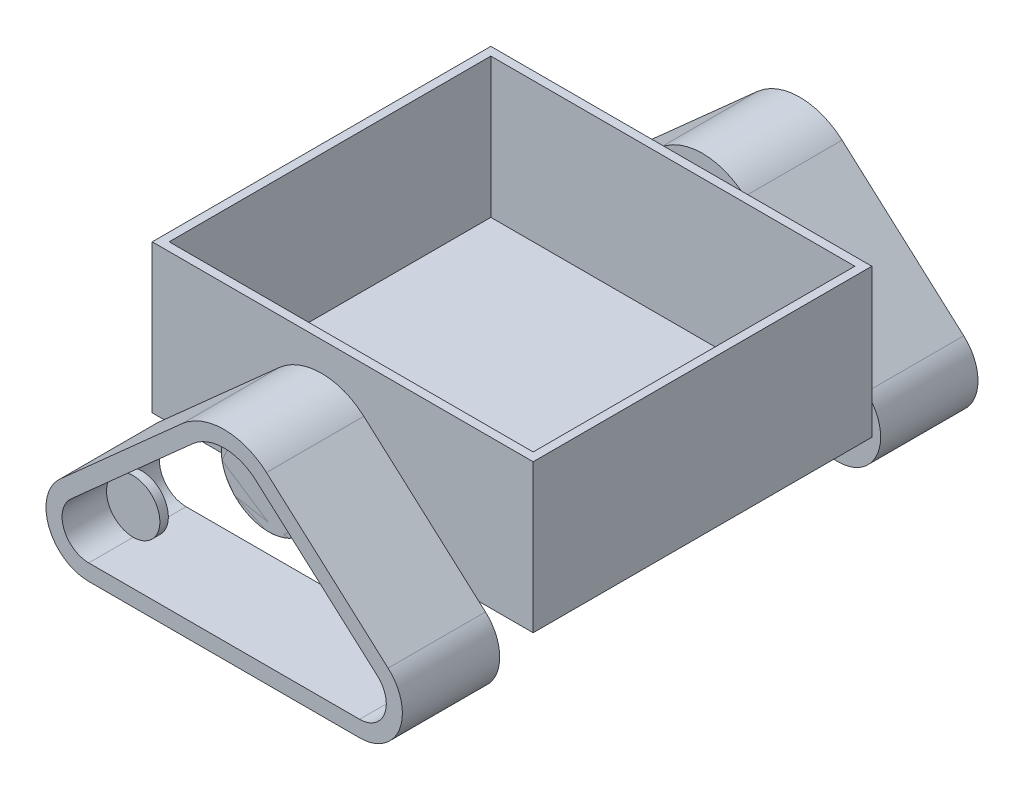
from build123d import *

# Parameters (mm, degrees)
SCHIZZO1_R                     = 31.5
ESTRUSIONE_ESTRUSIONE1_DEPTH   = 10
ESTRUSIONE_ESTRUSIONE1_2_DEPTH = 10
SCHIZZO1_R_2                   = 56
ESTRUSIONE_ESTRUSIONE1_3_DEPTH = 10
ESTRUSIONE_SOTTILE1_START      = -62.5
ESTRUSIONE_SOTTILE1_DEPTH      = 115
SCHIZZO3_W                     = 450
SCHIZZO3_H                     = 175
ESTRUSIONE_ESTRUSIONE2_DEPTH   = 400
SVUOTA1_T                      = -10
RIPETIZIONE_START              = 565
RIPETIZIONE_A_L2_OUTLINE_R     = 56
RIPETIZIONE_A_L2_DEPTH         = 10
RIPETIZIONE_A_L2_2_OUTLINE_R   = 31.5
RIPETIZIONE_A_L2_2_DEPTH       = 10
RIPETIZIONE_START_2            = 512.5
RIPETIZIONE_A_L2_3_DEPTH       = 115
RIPETIZIONE_A_L2_4_DEPTH       = 10


# Read off the part's stored shape, not the designer's step: Ripetizione a L2
with BuildPart() as part:
    # Schizzo1 → Estrusione-Estrusione1 (new body)
    with BuildSketch(Plane.XY):
        with Locations((-160, 0)):
            Circle(SCHIZZO1_R)
    extrude(amount=ESTRUSIONE_ESTRUSIONE1_DEPTH)



with BuildPart() as body_2:
    # Schizzo1 → Estrusione-Estrusione1 2 (new body)
    with BuildSketch(Plane.XY):
        with Locations((160, 0)):
            Circle(SCHIZZO1_R)
    extrude(amount=ESTRUSIONE_ESTRUSIONE1_2_DEPTH)


with BuildPart() as body_3:
    # Schizzo1 → Estrusione-Estrusione1 3 (new body)
    with BuildSketch(Plane.XY):
        with Locations((0, 110)):
            Circle(SCHIZZO1_R_2)
    extrude(amount=ESTRUSIONE_ESTRUSIONE1_3_DEPTH)


with BuildPart() as part_1:
    add(part.part)

    add(body_2.part)  # Estrusione-Sottile1 merges body 2

    add(body_3.part)  # Estrusione-Sottile1 merges body 3
    # Schizzo2 → Estrusione-Sottile1 (add)
    with BuildSketch(Plane.XY.offset(10).offset(ESTRUSIONE_SOTTILE1_START)):
        with BuildLine():
            Line((193.631961771, 37.671489849), (49.948458076, 165.947757201))
            ThreePointArc((49.948458076, 165.947757201), (0, 185), (-49.948458076, 165.947757201))
            Line((-49.948458076, 165.947757201), (-193.631961771, 37.671489849))
            ThreePointArc((-193.631961771, 37.671489849), (-207.184002784, -17.997774343), (-160, -50.5))
            Line((-160, -50.5), (160, -50.5))
            ThreePointArc((160, -50.5), (207.184002784, -17.997774343), (193.631961771, 37.671489849))
        make_face()
        with BuildLine():
            Line((180.978352392, 23.498058025), (37.294848697, 151.774325377))
            ThreePointArc((37.294848697, 151.774325377), (0, 166), (-37.294848697, 151.774325377))
            Line((-37.294848697, 151.774325377), (-180.978352392, 23.498058025))
            ThreePointArc((-180.978352392, 23.498058025), (-189.431605697, -11.226334491), (-160, -31.5))
            Line((-160, -31.5), (160, -31.5))
            ThreePointArc((160, -31.5), (189.431605697, -11.226334491), (180.978352392, 23.498058025))
        make_face(mode=Mode.SUBTRACT)
    extrude(amount=ESTRUSIONE_SOTTILE1_DEPTH)


with BuildPart() as body_2_2:
    # Schizzo3 → Estrusione-Estrusione2 (new body)
    with BuildSketch(Plane.XY.offset(87.5)):
        with Locations((0, 107)):
            Rectangle(SCHIZZO3_W, SCHIZZO3_H)
    extrude(amount=ESTRUSIONE_ESTRUSIONE2_DEPTH)

    # Svuota1
    svuota1_openings = [body_2_2.faces().sort_by_distance(p)[0] for p in [
        (0, 194.5, 287.5),
    ]]
    offset(amount=SVUOTA1_T, openings=svuota1_openings, kind=Kind.INTERSECTION)


with BuildPart() as body_3_2:
    # Ripetizione a L2 outline → Ripetizione a L2 (new body)
    with BuildSketch(Plane.XY.offset(RIPETIZIONE_START)):
        with Locations((0, 110)):
            Circle(RIPETIZIONE_A_L2_OUTLINE_R)
    extrude(amount=RIPETIZIONE_A_L2_DEPTH)


with BuildPart() as body_4:
    # Ripetizione a L2 2 outline → Ripetizione a L2 2 (new body)
    with BuildSketch(Plane.XY.offset(RIPETIZIONE_START)):
        with Locations((160, 0)):
            Circle(RIPETIZIONE_A_L2_2_OUTLINE_R)
    extrude(amount=RIPETIZIONE_A_L2_2_DEPTH)


with BuildPart() as body_5:
    # Ripetizione a L2 3 outline → Ripetizione a L2 3 (new body)
    with BuildSketch(Plane.XY.offset(RIPETIZIONE_START_2)):
        with BuildLine():
            ThreePointArc((49.948458076, 165.947757201), (0, 185), (-49.948458076, 165.947757201))
            Line((-49.948458076, 165.947757201), (-193.631961771, 37.671489849))
            ThreePointArc((-193.631961771, 37.671489849), (-207.184002784, -17.997774343), (-160, -50.5))
            Line((-160, -50.5), (160, -50.5))
            ThreePointArc((160, -50.5), (207.184002784, -17.997774343), (193.631961771, 37.671489849))
            Line((193.631961771, 37.671489849), (49.948458076, 165.947757201))
        make_face()
        with BuildLine():
            Line((-180.978352392, 23.498058025), (-37.294848697, 151.774325377))
            ThreePointArc((-37.294848697, 151.774325377), (0, 166), (37.294848697, 151.774325377))
            Line((37.294848697, 151.774325377), (180.978352392, 23.498058025))
            ThreePointArc((180.978352392, 23.498058025), (189.431605697, -11.226334491), (160, -31.5))
            Line((160, -31.5), (-160, -31.5))
            ThreePointArc((-160, -31.5), (-189.431605697, -11.226334491), (-180.978352392, 23.498058025))
        make_face(mode=Mode.SUBTRACT)
    extrude(amount=RIPETIZIONE_A_L2_3_DEPTH)

    # Ripetizione a L2 4 outline → Ripetizione a L2 4 (add)
    with BuildSketch(Plane.XY.offset(RIPETIZIONE_START)):
        with BuildLine():
            ThreePointArc((37.294848697, 151.774325377), (0, 166), (-37.294848697, 151.774325377))
            ThreePointArc((-37.294848697, 151.774325377), (0, 54), (37.294848697, 151.774325377))
        make_face()
        with BuildLine():
            ThreePointArc((-160, -31.5), (-130.568394303, 11.226334492), (-180.978352392, 23.498058025))
            ThreePointArc((-180.978352392, 23.498058025), (-189.431605697, -11.226334491), (-160, -31.5))
        make_face()
        with BuildLine():
            ThreePointArc((160, -31.5), (189.431605697, -11.226334491), (180.978352392, 23.498058025))
            ThreePointArc((180.978352392, 23.498058025), (130.568394303, 11.226334492), (160, -31.5))
        make_face()
    extrude(amount=RIPETIZIONE_A_L2_4_DEPTH)


solid = Compound([part_1.part, body_2_2.part, body_3_2.part, body_4.part, body_5.part])
